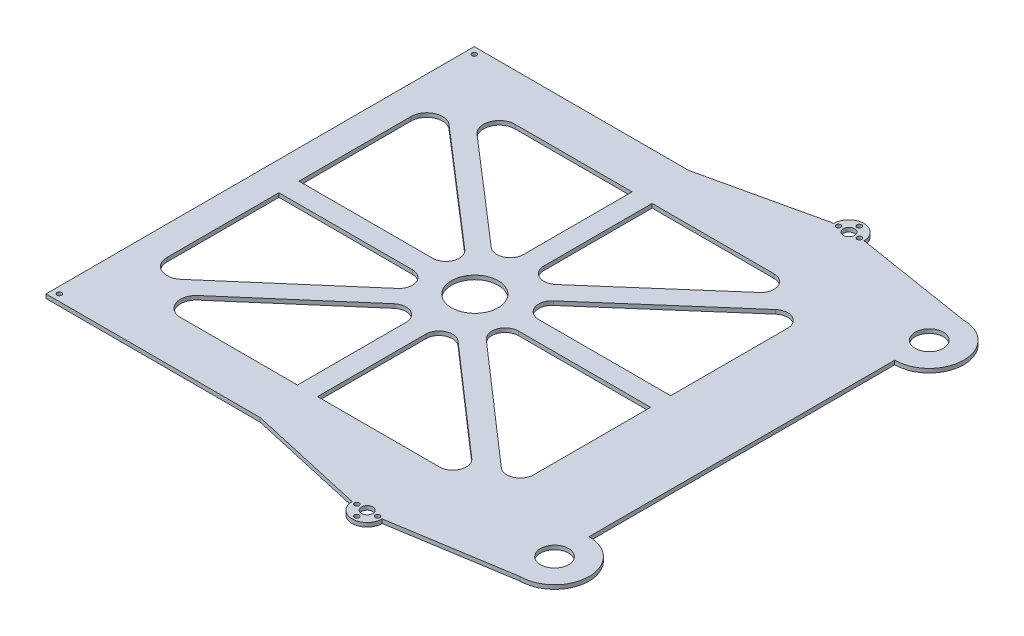
from build123d import *

# Parameters (mm, degrees)
SKETCH1_R             = 1.75
BOSS_EXTRUDE2_DEPTH   = 3
SKETCH1_R_2           = 4.25
SKETCH1_R_3           = 10.5
BOSS_EXTRUDE2_2_DEPTH = 3
FILLET1_R             = 10
SKETCH2_R             = 17.5
CUT_EXTRUDE1_DEPTH    = 10


with BuildPart() as part:
    # Sketch1 → Boss-Extrude2 (new body)
    with BuildSketch(Plane(origin=(0, 0, 0), x_dir=(1, 0, 0), z_dir=(0, 1, 0))):
        with Locations((153.848996294, -160.649182064)):
            Circle(SKETCH1_R)
    boss_extrude2 = extrude(amount=BOSS_EXTRUDE2_DEPTH)


with BuildPart() as body_2:
    # Sketch1 → Boss-Extrude2 2 (new body)
    with BuildSketch(Plane(origin=(0, 0, 0), x_dir=(1, 0, 0), z_dir=(0, 1, 0))):
        with BuildLine():
            Line((-160.429103157, 154.350817936), (-0.429103157, 154.350817936))
            Line((-0.429103157, 154.350817936), (88.320896843, 174.350817936))
            ThreePointArc((88.320896843, 174.350817936), (99.570896843, 185.600817936), (110.820896843, 174.350817936))
            Line((110.820896843, 174.350817936), (199.570896843, 160.150817936))
            ThreePointArc((199.570896843, 160.150817936), (225.370896843, 134.350817936), (199.570896843, 108.550817936))
            Line((199.570896843, 108.550817936), (199.570896843, -5.649182064))
            Line((199.570896843, -5.649182064), (140.384809243, -5.649182064))
            Line((140.384809243, -5.649182064), (17.871310963, -5.649182064))
            Line((17.871310963, -5.649182064), (-17.871310963, -5.649182064))
            Line((-17.871310963, -5.649182064), (-140.384809243, -5.649182064))
            Line((-140.384809243, -5.649182064), (-160.429103157, -5.649182064))
            Line((-160.429103157, -5.649182064), (-160.429103157, 154.350817936))
        make_face()
        with Locations((99.570896843, 174.350817936)):
            Circle(SKETCH1_R_2, mode=Mode.SUBTRACT)
        with Locations((199.570896843, 134.350817936)):
            Circle(SKETCH1_R_3, mode=Mode.SUBTRACT)
        with Locations((-155.429103157, 149.350817936)):
            Circle(SKETCH1_R, mode=Mode.SUBTRACT)
        with Locations((153.848996294, 149.350817936)):
            Circle(SKETCH1_R, mode=Mode.SUBTRACT)
        with Locations((107.320896843, 174.350817936)):
            Circle(SKETCH1_R, mode=Mode.SUBTRACT)
        with Locations((91.820896843, 174.350817936)):
            Circle(SKETCH1_R, mode=Mode.SUBTRACT)
        with Locations((99.570896843, 182.100817936)):
            Circle(SKETCH1_R, mode=Mode.SUBTRACT)
        with BuildLine():
            Line((98.615479423, 119.350817936), (7.5, 119.350817936))
            Line((7.5, 119.350817936), (7.5, 16.506675056))
            Line((7.5, 16.506675056), (105.19311723, 101.818575184))
            ThreePointArc((105.19311723, 101.818575184), (107.978236162, 112.863478785), (98.615479423, 119.350817936))
        make_face(mode=Mode.SUBTRACT)
        with BuildLine():
            Line((-102.646063409, 98.639396028), (-7.5, 16.39642362))
            Line((-7.5, 16.39642362), (-7.5, 119.350817936))
            Line((-7.5, 119.350817936), (-94.935387285, 119.350817936))
            ThreePointArc((-94.935387285, 119.350817936), (-105.985472395, 111.673646608), (-102.646063409, 98.639396028))
        make_face(mode=Mode.SUBTRACT)
        with BuildLine():
            Line((122.271358487, 96.81800419), (13.521694655, 1.850817936))
            Line((13.521694655, 1.850817936), (138.848996294, 1.850817936))
            Line((138.848996294, 1.850817936), (138.848996294, 89.285761438))
            ThreePointArc((138.848996294, 89.285761438), (132.985638769, 98.390056525), (122.271358487, 96.81800419))
        make_face(mode=Mode.SUBTRACT)
        with BuildLine():
            Line((-119.347301526, 94.437659895), (-12.234519996, 1.850817936))
            Line((-12.234519996, 1.850817936), (-138.848996294, 1.850817936))
            Line((-138.848996294, 1.850817936), (-138.848996294, 85.517256632))
            ThreePointArc((-138.848996294, 85.517256632), (-131.96263843, 96.23977608), (-119.347301526, 94.437659895))
        make_face(mode=Mode.SUBTRACT)
    boss_extrude2_2 = extrude(amount=BOSS_EXTRUDE2_2_DEPTH)


with BuildPart() as part_1:
    add(part.part)

    add(body_2.part)  # Mirror1 merges body 2
    # Mirror1: Boss-Extrude2, Boss-Extrude2 2 across plane
    add(boss_extrude2.mirror(Plane(origin=(199.570896843, 3, 5.649182064), x_dir=(1, 0, 0), z_dir=(0, 0, -1))))
    add(boss_extrude2_2.mirror(Plane(origin=(199.570896843, 3, 5.649182064), x_dir=(1, 0, 0), z_dir=(0, 0, -1))))

    # Fillet1
    fillet1_edges = [part_1.edges().sort_by_distance(p)[0] for p in [
        (-12.234519996, 1.5, 13.149182064),
        (-12.234519996, 1.5, -1.850817936),
        (-7.5, 1.5, -16.39642362),
        (7.5, 1.5, -16.506675056),
        (13.521694655, 1.5, -1.850817936),
        (13.521694655, 1.5, 13.149182064),
        (7.5, 1.5, 27.805039185),
        (-7.5, 1.5, 27.694787748),
    ]]
    fillet(fillet1_edges, radius=FILLET1_R)

    # Sketch2 → Cut-Extrude1 (cut)
    with BuildSketch(Plane(origin=(0, 3, 0), x_dir=(1, 0, 0), z_dir=(0, 1, 0))):
        with Locations((0, -5.649182064)):
            Circle(SKETCH2_R)
    extrude(amount=-CUT_EXTRUDE1_DEPTH, mode=Mode.SUBTRACT)


solid = part_1.part
